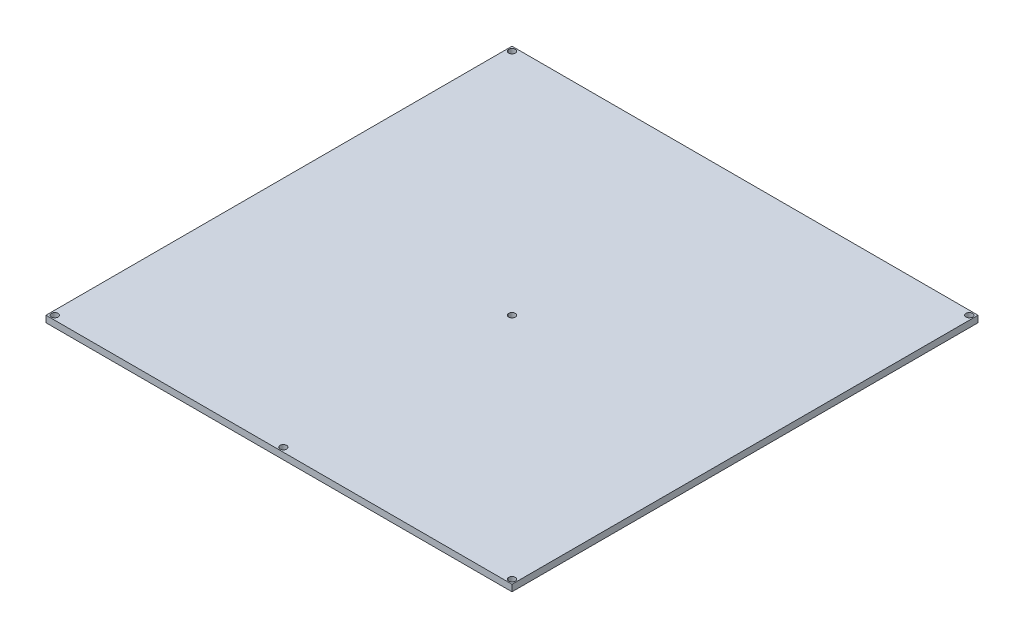
from build123d import *

# Parameters (mm, degrees)
SKETCH1_W           = 213
SKETCH1_H           = 213
SKETCH1_R           = 1.5
BOSS_EXTRUDE1_DEPTH = 3


with BuildPart() as part:
    # Sketch1 → Boss-Extrude1 (new body)
    with BuildSketch(Plane(origin=(0, 0, 0), x_dir=(1, 0, 0), z_dir=(0, 1, 0))):
        Rectangle(SKETCH1_W, SKETCH1_H)
        with Locations((-104.5, 104.5)):
            Circle(SKETCH1_R, mode=Mode.SUBTRACT)
        with Locations((104.5, 104.5)):
            Circle(SKETCH1_R, mode=Mode.SUBTRACT)
        with Locations((-104.5, -104.5)):
            Circle(SKETCH1_R, mode=Mode.SUBTRACT)
        with Locations((104.5, -104.5)):
            Circle(SKETCH1_R, mode=Mode.SUBTRACT)
        Circle(SKETCH1_R, mode=Mode.SUBTRACT)
        with Locations((0, -104.5)):
            Circle(SKETCH1_R, mode=Mode.SUBTRACT)
    extrude(amount=BOSS_EXTRUDE1_DEPTH)


solid = part.part
